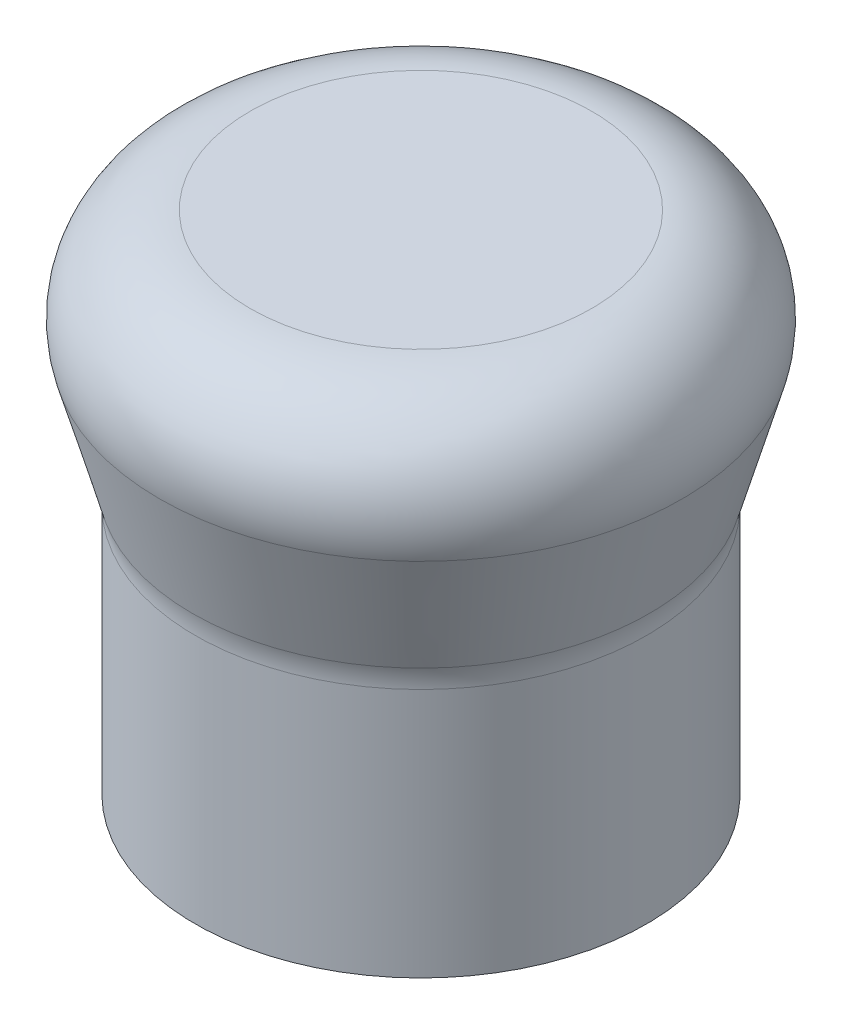
from build123d import *

# Parameters (mm, degrees)
CONG_1_R = 1.5
CONG_2_R = 3
COQUE1_T = 1


with BuildPart() as part:
    # Esquisse1 → Révolution1 (revolve)
    with BuildSketch(Plane.XY):
        Polygon((10, 0), (10, 7.060491131), (11.528559936, 12.44684519), (5, 12.44684519), (5, 0), align=None)
    revolve(axis=Axis((5, 0, 0), (0, 1, 0)))

    # Congé1
    cong_1_edges = [part.edges().sort_by_distance(p)[0] for p in [
        (-1.528559936, 12.44684519, 0),
    ]]
    fillet(cong_1_edges, radius=CONG_1_R)

    # Congé2
    cong_2_edges = [part.edges().sort_by_distance(p)[0] for p in [
        (0, 7.060491131, 0),
    ]]
    fillet(cong_2_edges, radius=CONG_2_R)

    # Coque1
    coque1_openings = [part.faces().sort_by_distance(p)[0] for p in [
        (5, 0, 0),
    ]]
    offset(amount=COQUE1_T, openings=coque1_openings, kind=Kind.INTERSECTION)


solid = part.part
